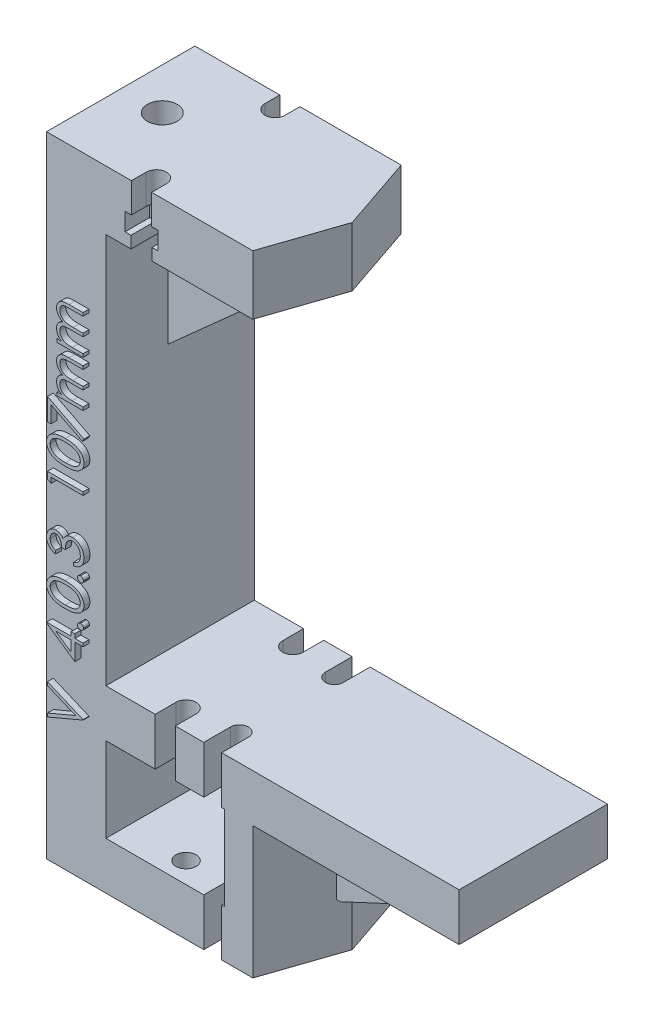
from build123d import *
from build123d.topology import SkipClean

# Parameters (mm, degrees)
BOSS_EXTRUDE2_DEPTH       = 12.5
BOSS_EXTRUDE3_DEPTH       = 25
CUT_EXTRUDE2_REACH        = 111.73
CUT_EXTRUDE3_REACH        = 111.73
BOSS_EXTRUDE5_DEPTH       = 2
CUT_EXTRUDE6_REACH        = 111.73
SKETCH30_W                = 10
SKETCH30_H                = 25
CUT_EXTRUDE8_DEPTH        = 8
CUT_EXTRUDE9_DEPTH        = 81.845467405
CUT_EXTRUDE9_DEPTH_BACK   = 81.845467405
BOSS_EXTRUDE6_DEPTH       = 1
BOSS_EXTRUDE7_DEPTH       = 40
BOSS_EXTRUDE17_DEPTH      = 2
CUT_EXTRUDE10_DEPTH       = 3
SKETCH39_W                = 4
SKETCH39_H                = 14.25
BOSS_EXTRUDE18_DEPTH      = 2.5
F_5_0MM_DOWEL_HOLE1_D     = 5
F_5_0MM_DOWEL_HOLE1_DEPTH = 5
F_5_0MM_DOWEL_HOLE1_TIP   = 1.502151548
SKETCH43_W                = 6
SKETCH43_H                = 4
BOSS_EXTRUDE19_DEPTH      = 2
BOSS_EXTRUDE20_DEPTH      = 8


with BuildPart() as part:
    # Sketch6 → Boss-Extrude2 (new, symmetric)
    with BuildSketch(Plane.XY):
        Polygon((-25, 53.055), (15, 53.055), (15, 45.055), (-15, 45.055), (-15, -45.055), (25, -45.055), (25, -53.055), (-25, -53.055), align=None)
    extrude(amount=BOSS_EXTRUDE2_DEPTH, both=True)

    # Sketch15 → Boss-Extrude3 (add)
    with BuildSketch(Plane.XY.offset(12.5)):
        Polygon((-15, -22.805), (15, -22.805), (15, -53.055), (5, -53.055), (5, -30.805), (-15, -30.805), align=None)
    extrude(amount=-BOSS_EXTRUDE3_DEPTH)

    # Sketch20 → Cut-Extrude2 (cut, up to next)
    with BuildSketch(Plane(origin=(0, 53.055, 0), x_dir=(1, 0, 0), z_dir=(0, 1, 0)), mode=Mode.PRIVATE) as cut_extrude2_sk1:
        with BuildLine():
            Line((-10.7, 12.5), (-10.7, 10))
            ThreePointArc((-10.7, 10), (-9, 8.3), (-7.3, 10))
            Line((-7.3, 10), (-7.3, 12.5))
            Line((-7.3, 12.5), (-10.7, 12.5))
        make_face()
    cut_extrude2_tool1 = extrude(cut_extrude2_sk1.sketch, amount=-CUT_EXTRUDE2_REACH, mode=Mode.PRIVATE) & part.part
    # Sketch20 → Cut-Extrude2 (cut, up to next)
    with BuildSketch(Plane(origin=(0, 53.055, 0), x_dir=(1, 0, 0), z_dir=(0, 1, 0)), mode=Mode.PRIVATE) as cut_extrude2_sk2:
        with BuildLine():
            Line((-7.3, -12.5), (-10.7, -12.5))
            Line((-10.7, -12.5), (-10.7, -10))
            ThreePointArc((-10.7, -10), (-9, -8.3), (-7.3, -10))
            Line((-7.3, -10), (-7.3, -12.5))
        make_face()
    cut_extrude2_tool2 = extrude(cut_extrude2_sk2.sketch, amount=-CUT_EXTRUDE2_REACH, mode=Mode.PRIVATE) & part.part
    add(cut_extrude2_tool1.solids().sort_by_distance((-9, 53.055, -10.563642))[0], mode=Mode.SUBTRACT)
    add(cut_extrude2_tool2.solids().sort_by_distance((-9, 53.055, 10.563642))[0], mode=Mode.SUBTRACT)

    # Cut-Extrude3: up to this face of the body (flat: up to its plane)
    cut_extrude3_end = Plane(part.part.faces().sort_by_distance((0, -22.805, 0))[0])
    # Sketch21 → Cut-Extrude3 (cut, up to the picked face)
    with BuildSketch(Plane.XZ.offset(53.055), mode=Mode.PRIVATE) as cut_extrude3_sk1:
        with BuildLine():
            Line((-6.7, 12.5), (-6.7, 9))
            ThreePointArc((-6.7, 9), (-5, 7.3), (-3.3, 9))
            Line((-3.3, 9), (-3.3, 12.5))
            Line((-3.3, 12.5), (-6.7, 12.5))
        make_face()
    cut_extrude3_tool1 = split(extrude(cut_extrude3_sk1.sketch, amount=-CUT_EXTRUDE3_REACH, mode=Mode.PRIVATE), bisect_by=cut_extrude3_end, keep=Keep.BOTH, mode=Mode.PRIVATE)
    # Sketch21 → Cut-Extrude3 (cut, up to the picked face)
    with BuildSketch(Plane.XZ.offset(53.055), mode=Mode.PRIVATE) as cut_extrude3_sk2:
        with BuildLine():
            Line((-3.3, -12.5), (-6.7, -12.5))
            Line((-6.7, -12.5), (-6.7, -9))
            ThreePointArc((-6.7, -9), (-5, -7.3), (-3.3, -9))
            Line((-3.3, -9), (-3.3, -12.5))
        make_face()
    cut_extrude3_tool2 = split(extrude(cut_extrude3_sk2.sketch, amount=-CUT_EXTRUDE3_REACH, mode=Mode.PRIVATE), bisect_by=cut_extrude3_end, keep=Keep.BOTH, mode=Mode.PRIVATE)
    add(cut_extrude3_tool1.solids().sort_by(Axis((-5, -53.055, 10.067524), (0, 1, 0)))[0], mode=Mode.SUBTRACT)
    add(cut_extrude3_tool2.solids().sort_by(Axis((-5, -53.055, -10.067524), (0, 1, 0)))[0], mode=Mode.SUBTRACT)

    # Sketch22 → Boss-Extrude5 (add, symmetric)
    with BuildSketch(Plane.XY):
        Polygon((-15, 21.805), (11, 45.055), (-15, 45.055), align=None)
    extrude(amount=BOSS_EXTRUDE5_DEPTH, both=True)

    # Cut-Extrude6: up to this face of the body (flat: up to its plane)
    cut_extrude6_end = Plane(part.part.faces().sort_by_distance((0.229244521, -22.805, 0))[0])
    # Sketch24 → Cut-Extrude6 (cut, up to the picked face)
    with BuildSketch(Plane.XZ.offset(53.055), mode=Mode.PRIVATE) as cut_extrude6_sk1:
        with BuildLine():
            Line((1.49, -12.5), (1.49, -8))
            ThreePointArc((1.49, -8), (3, -6.49), (4.51, -8))
            Line((4.51, -8), (4.51, -12.5))
            Line((4.51, -12.5), (1.49, -12.5))
        make_face()
    cut_extrude6_tool1 = split(extrude(cut_extrude6_sk1.sketch, amount=-CUT_EXTRUDE6_REACH, mode=Mode.PRIVATE), bisect_by=cut_extrude6_end, keep=Keep.BOTH, mode=Mode.PRIVATE)
    # Sketch24 → Cut-Extrude6 (cut, up to the picked face)
    with BuildSketch(Plane.XZ.offset(53.055), mode=Mode.PRIVATE) as cut_extrude6_sk2:
        with BuildLine():
            Line((4.51, 12.5), (1.49, 12.5))
            Line((1.49, 12.5), (1.49, 8))
            ThreePointArc((1.49, 8), (3, 6.49), (4.51, 8))
            Line((4.51, 8), (4.51, 12.5))
        make_face()
    cut_extrude6_tool2 = split(extrude(cut_extrude6_sk2.sketch, amount=-CUT_EXTRUDE6_REACH, mode=Mode.PRIVATE), bisect_by=cut_extrude6_end, keep=Keep.BOTH, mode=Mode.PRIVATE)
    add(cut_extrude6_tool1.solids().sort_by(Axis((3, -53.055, -9.647036), (0, 1, 0)))[0], mode=Mode.SUBTRACT)
    add(cut_extrude6_tool2.solids().sort_by(Axis((3, -53.055, 9.647036), (0, 1, 0)))[0], mode=Mode.SUBTRACT)

    # Sketch30 → Cut-Extrude8 (cut)
    with BuildSketch(Plane(origin=(0, -45.055, 0), x_dir=(1, 0, 0), z_dir=(0, 1, 0))):
        with Locations((20, 0)):
            Rectangle(SKETCH30_W, SKETCH30_H)
    extrude(amount=-CUT_EXTRUDE8_DEPTH, mode=Mode.SUBTRACT)

    # Sketch34 → Cut-Extrude9 (cut, two sides: drawn at the far end of the back side and taken through both)
    with BuildSketch(Plane(origin=(0, -22.805, 0), x_dir=(1, 0, 0), z_dir=(0, 1, 0)).offset(-CUT_EXTRUDE9_DEPTH_BACK)):
        Polygon((9.755, 12.5), (14, 0), (9.755, -12.5), (15, -12.5), (15, 12.5), align=None)
    extrude(amount=CUT_EXTRUDE9_DEPTH + CUT_EXTRUDE9_DEPTH_BACK, mode=Mode.SUBTRACT)

    # Sketch35 → Boss-Extrude6 (add)
    # profile 1 of 11: a face of its own
    with BuildSketch(Plane.XY.offset(12.5)):
        with BuildLine():
            Line((-22.234615385, 24.192307692), (-22.234615385, 24.730769231))
            Line((-22.234615385, 24.730769231), (-21.472596154, 24.730769231))
            add(Edge.make_bspline(
                [(-21.472596154, 24.730769231), (-21.539260614, 24.779256002), (-21.666996111, 24.872161304), (-21.835322312, 25.024502423), (-21.978170577, 25.176690044), (-22.053158357, 25.286290127), (-22.089182692, 25.338942308)],
                knots=[0, 0, 0, 0, 1.134379233, 2.173579362, 3.122582517, 4, 4, 4, 4], degree=3))
            add(Edge.make_bspline(
                [(-22.089182692, 25.338942308), (-22.123477604, 25.4107103), (-22.191468256, 25.552992414), (-22.260440071, 25.778282514), (-22.302825959, 26.008810519), (-22.308622599, 26.164481742), (-22.311538462, 26.242788462)],
                knots=[0, 0, 0, 0, 1.014936303, 2.012140481, 3.000054389, 4, 4, 4, 4], degree=3))
            add(Edge.make_bspline(
                [(-22.311538462, 26.242788462), (-22.309746507, 26.295747856), (-22.306200324, 26.400551651), (-22.283126386, 26.555839071), (-22.243239974, 26.706452288), (-22.187690322, 26.851510678), (-22.120389321, 26.988153705), (-22.041520642, 27.113523249), (-21.952811526, 27.225533553), (-21.851715073, 27.325979796), (-21.732621113, 27.415508457), (-21.593245652, 27.497285019), (-21.431579845, 27.573850863), (-21.314358593, 27.616020032), (-21.252644231, 27.638221154)],
                knots=[0, 0, 0, 0, 1.009731074, 1.9982035, 2.985760524, 3.974587072, 4.955028184, 5.885388378, 6.793242796, 7.673688873, 8.594941726, 9.625945874, 10.750113716, 12, 12, 12, 12], degree=3))
            add(Edge.make_bspline(
                [(-21.252644231, 27.638221154), (-21.295028488, 27.661726586), (-21.378434755, 27.707981975), (-21.496484081, 27.785642641), (-21.60687165, 27.867038436), (-21.709826129, 27.952731426), (-21.80452798, 28.043081494), (-21.892909205, 28.136632908), (-21.972522012, 28.235480687), (-22.065676161, 28.372206048), (-22.164941217, 28.549911297), (-22.248837086, 28.77483801), (-22.302266055, 29.00792588), (-22.308427236, 29.166379541), (-22.311538462, 29.246394231)],
                knots=[0, 0, 0, 0, 0.861026002, 1.694378253, 2.508904292, 3.297437177, 4.073006284, 4.833627155, 5.583069468, 6.325614666, 7.772320565, 9.187282923, 10.579656144, 12, 12, 12, 12], degree=3))
            add(Edge.make_bspline(
                [(-22.311538462, 29.246394231), (-22.308800813, 29.319918084), (-22.30344297, 29.463811403), (-22.260375554, 29.672941382), (-22.189095041, 29.868811401), (-22.088852441, 30.049345438), (-21.963482389, 30.212445671), (-21.814139706, 30.354757151), (-21.641369838, 30.473150863), (-21.480136821, 30.552300297), (-21.337524673, 30.604991229), (-21.215460368, 30.637898852), (-21.081004779, 30.666408831), (-20.934266049, 30.690580995), (-20.774947077, 30.708056361), (-20.602974661, 30.721047344), (-20.418199364, 30.729827776), (-20.290715767, 30.730449), (-20.225, 30.730769231)],
                knots=[0, 0, 0, 0, 1.209392158, 2.366897878, 3.497663982, 4.628180075, 5.751982922, 6.871462727, 8.009245026, 9.185977379, 9.818124946, 10.509294143, 11.264649411, 12.079922034, 12.956003306, 13.901808055, 14.918415426, 16, 16, 16, 16], degree=3))
            Line((-20.225, 30.730769231), (-17.85, 30.730769231))
            Line((-17.85, 30.730769231), (-17.85, 30.192307692))
            Line((-17.85, 30.192307692), (-20.227403846, 30.192307692))
            add(Edge.make_bspline(
                [(-20.227403846, 30.192307692), (-20.283496341, 30.192174827), (-20.391297586, 30.191919479), (-20.546014988, 30.187293303), (-20.687050044, 30.178620907), (-20.814586843, 30.168324713), (-20.928585361, 30.154407218), (-21.028726359, 30.136031786), (-21.115466742, 30.116719418), (-21.211587244, 30.08455919), (-21.317531947, 30.033623512), (-21.430954892, 29.954624495), (-21.530458078, 29.856584928), (-21.616841526, 29.742755056), (-21.687129696, 29.613262824), (-21.737313417, 29.470517893), (-21.768382244, 29.315438165), (-21.771478124, 29.2080846), (-21.773076923, 29.152644231)],
                knots=[0, 0, 0, 0, 1.253367865, 2.408782419, 3.458086102, 4.410454771, 5.267690823, 6.022776742, 6.685072793, 7.251272234, 8.28433411, 9.300106008, 10.325693114, 11.39283262, 12.482417211, 13.60372085, 14.762494729, 16, 16, 16, 16], degree=3))
            add(Edge.make_bspline(
                [(-21.773076923, 29.152644231), (-21.76997183, 29.084694057), (-21.763840459, 28.950518493), (-21.717743069, 28.753511816), (-21.641126709, 28.566211293), (-21.536341225, 28.389881475), (-21.407618816, 28.229169393), (-21.255294615, 28.090400459), (-21.082742522, 27.975853276), (-20.92307314, 27.898271209), (-20.779638783, 27.849257532), (-20.654327211, 27.816912839), (-20.511520556, 27.791601351), (-20.352893327, 27.768322423), (-20.177094809, 27.752611914), (-19.985210505, 27.738733404), (-19.775926859, 27.732154871), (-19.63085208, 27.731242787), (-19.555528846, 27.730769231)],
                knots=[0, 0, 0, 0, 1.091136677, 2.154576964, 3.231646693, 4.331257757, 5.439166191, 6.528231045, 7.628049365, 8.756709726, 9.369482423, 10.061167346, 10.833871401, 11.698739631, 12.636505159, 13.668922441, 14.789697963, 16, 16, 16, 16], degree=3))
            Line((-19.555528846, 27.730769231), (-17.85, 27.730769231))
            Line((-17.85, 27.730769231), (-17.85, 27.192307692))
            Line((-17.85, 27.192307692), (-20.079567308, 27.192307692))
            add(Edge.make_bspline(
                [(-20.079567308, 27.192307692), (-20.14247014, 27.192171525), (-20.263488866, 27.191909552), (-20.437032312, 27.187321582), (-20.594885583, 27.178601651), (-20.736865264, 27.168520735), (-20.862713168, 27.154017498), (-20.973104451, 27.137543847), (-21.067760922, 27.118088397), (-21.17158701, 27.085879819), (-21.285945136, 27.036637629), (-21.407983755, 26.957527458), (-21.514604324, 26.858340568), (-21.607034555, 26.743272236), (-21.682563185, 26.612793184), (-21.73505501, 26.468346445), (-21.767080197, 26.312298153), (-21.771040318, 26.204484643), (-21.773076923, 26.149038462)],
                knots=[0, 0, 0, 0, 1.320285835, 2.540097241, 3.643286278, 4.638464947, 5.527188413, 6.301437306, 6.980978976, 7.552872752, 8.580906713, 9.583871393, 10.589652407, 11.624542289, 12.671761011, 13.738681301, 14.837052193, 16, 16, 16, 16], degree=3))
            add(Edge.make_bspline(
                [(-21.773076923, 26.149038462), (-21.770453269, 26.08386783), (-21.765224419, 25.953985075), (-21.718160076, 25.763181453), (-21.644438314, 25.578921235), (-21.542166243, 25.404138051), (-21.415474903, 25.243567798), (-21.266504635, 25.10293032), (-21.097243672, 24.985144479), (-20.939930706, 24.906215351), (-20.800047184, 24.855613989), (-20.680645905, 24.822438089), (-20.548314964, 24.793318235), (-20.402780158, 24.771917094), (-20.24469108, 24.751192324), (-20.073236398, 24.741202166), (-19.888570334, 24.731478125), (-19.761074488, 24.731011325), (-19.694951923, 24.730769231)],
                knots=[0, 0, 0, 0, 1.09880202, 2.189873405, 3.297736452, 4.440485332, 5.596193377, 6.739822772, 7.886349079, 9.066114917, 9.699498033, 10.395421758, 11.156987371, 11.985484089, 12.878178647, 13.847820956, 14.883825601, 16, 16, 16, 16], degree=3))
            Line((-19.694951923, 24.730769231), (-17.85, 24.730769231))
            Line((-17.85, 24.730769231), (-17.85, 24.192307692))
            Line((-17.85, 24.192307692), (-22.234615385, 24.192307692))
        make_face()
    # profile 2 of 11: a face of its own
    with BuildSketch(Plane.XY.offset(12.5)):
        with BuildLine():
            Line((-22.234615385, 16.423076923), (-22.234615385, 16.961538462))
            Line((-22.234615385, 16.961538462), (-21.472596154, 16.961538462))
            add(Edge.make_bspline(
                [(-21.472596154, 16.961538462), (-21.539260614, 17.010025233), (-21.666996111, 17.102930535), (-21.835322312, 17.255271654), (-21.978170577, 17.407459275), (-22.053158357, 17.517059358), (-22.089182692, 17.569711538)],
                knots=[0, 0, 0, 0, 1.134379233, 2.173579362, 3.122582517, 4, 4, 4, 4], degree=3))
            add(Edge.make_bspline(
                [(-22.089182692, 17.569711538), (-22.123477604, 17.641479531), (-22.191468256, 17.783761645), (-22.260440071, 18.009051744), (-22.302825959, 18.239579749), (-22.308622599, 18.395250973), (-22.311538462, 18.473557692)],
                knots=[0, 0, 0, 0, 1.014936303, 2.012140481, 3.000054389, 4, 4, 4, 4], degree=3))
            add(Edge.make_bspline(
                [(-22.311538462, 18.473557692), (-22.309746507, 18.526517087), (-22.306200324, 18.631320881), (-22.283126386, 18.786608302), (-22.243239974, 18.937221519), (-22.187690322, 19.082279908), (-22.120389321, 19.218922936), (-22.041520642, 19.344292479), (-21.952811526, 19.456302784), (-21.851715073, 19.556749027), (-21.732621113, 19.646277688), (-21.593245652, 19.72805425), (-21.431579845, 19.804620094), (-21.314358593, 19.846789262), (-21.252644231, 19.868990385)],
                knots=[0, 0, 0, 0, 1.009731074, 1.9982035, 2.985760524, 3.974587072, 4.955028184, 5.885388378, 6.793242796, 7.673688873, 8.594941726, 9.625945874, 10.750113716, 12, 12, 12, 12], degree=3))
            add(Edge.make_bspline(
                [(-21.252644231, 19.868990385), (-21.295028488, 19.892495817), (-21.378434755, 19.938751206), (-21.496484081, 20.016411872), (-21.60687165, 20.097807667), (-21.709826129, 20.183500657), (-21.80452798, 20.273850725), (-21.892909205, 20.367402139), (-21.972522012, 20.466249918), (-22.065676161, 20.602975278), (-22.164941217, 20.780680527), (-22.248837086, 21.005607241), (-22.302266055, 21.238695111), (-22.308427236, 21.397148772), (-22.311538462, 21.477163462)],
                knots=[0, 0, 0, 0, 0.861026002, 1.694378253, 2.508904292, 3.297437177, 4.073006284, 4.833627155, 5.583069468, 6.325614666, 7.772320565, 9.187282923, 10.579656144, 12, 12, 12, 12], degree=3))
            add(Edge.make_bspline(
                [(-22.311538462, 21.477163462), (-22.308800813, 21.550687315), (-22.30344297, 21.694580634), (-22.260375554, 21.903710613), (-22.189095041, 22.099580632), (-22.088852441, 22.280114669), (-21.963482389, 22.443214902), (-21.814139706, 22.585526381), (-21.641369838, 22.703920094), (-21.480136821, 22.783069528), (-21.337524673, 22.83576046), (-21.215460368, 22.868668082), (-21.081004779, 22.897178062), (-20.934266049, 22.921350226), (-20.774947077, 22.938825592), (-20.602974661, 22.951816575), (-20.418199364, 22.960597007), (-20.290715767, 22.961218231), (-20.225, 22.961538462)],
                knots=[0, 0, 0, 0, 1.209392158, 2.366897878, 3.497663982, 4.628180075, 5.751982922, 6.871462727, 8.009245026, 9.185977379, 9.818124946, 10.509294143, 11.264649411, 12.079922034, 12.956003306, 13.901808055, 14.918415426, 16, 16, 16, 16], degree=3))
            Line((-20.225, 22.961538462), (-17.85, 22.961538462))
            Line((-17.85, 22.961538462), (-17.85, 22.423076923))
            Line((-17.85, 22.423076923), (-20.227403846, 22.423076923))
            add(Edge.make_bspline(
                [(-20.227403846, 22.423076923), (-20.283496341, 22.422944058), (-20.391297586, 22.42268871), (-20.546014988, 22.418062534), (-20.687050044, 22.409390138), (-20.814586843, 22.399093944), (-20.928585361, 22.385176449), (-21.028726359, 22.366801017), (-21.115466742, 22.347488649), (-21.211587244, 22.315328421), (-21.317531947, 22.264392743), (-21.430954892, 22.185393726), (-21.530458078, 22.087354159), (-21.616841526, 21.973524286), (-21.687129696, 21.844032054), (-21.737313417, 21.701287124), (-21.768382244, 21.546207396), (-21.771478124, 21.438853831), (-21.773076923, 21.383413462)],
                knots=[0, 0, 0, 0, 1.253367865, 2.408782419, 3.458086102, 4.410454771, 5.267690823, 6.022776742, 6.685072793, 7.251272234, 8.28433411, 9.300106008, 10.325693114, 11.39283262, 12.482417211, 13.60372085, 14.762494729, 16, 16, 16, 16], degree=3))
            add(Edge.make_bspline(
                [(-21.773076923, 21.383413462), (-21.76997183, 21.315463288), (-21.763840459, 21.181287724), (-21.717743069, 20.984281047), (-21.641126709, 20.796980524), (-21.536341225, 20.620650706), (-21.407618816, 20.459938624), (-21.255294615, 20.32116969), (-21.082742522, 20.206622507), (-20.92307314, 20.129040439), (-20.779638783, 20.080026763), (-20.654327211, 20.04768207), (-20.511520556, 20.022370582), (-20.352893327, 19.999091654), (-20.177094809, 19.983381145), (-19.985210505, 19.969502635), (-19.775926859, 19.962924102), (-19.63085208, 19.962012018), (-19.555528846, 19.961538462)],
                knots=[0, 0, 0, 0, 1.091136677, 2.154576964, 3.231646693, 4.331257757, 5.439166191, 6.528231045, 7.628049365, 8.756709726, 9.369482423, 10.061167346, 10.833871401, 11.698739631, 12.636505159, 13.668922441, 14.789697963, 16, 16, 16, 16], degree=3))
            Line((-19.555528846, 19.961538462), (-17.85, 19.961538462))
            Line((-17.85, 19.961538462), (-17.85, 19.423076923))
            Line((-17.85, 19.423076923), (-20.079567308, 19.423076923))
            add(Edge.make_bspline(
                [(-20.079567308, 19.423076923), (-20.14247014, 19.422940756), (-20.263488866, 19.422678783), (-20.437032312, 19.418090813), (-20.594885583, 19.409370882), (-20.736865264, 19.399289966), (-20.862713168, 19.384786728), (-20.973104451, 19.368313078), (-21.067760922, 19.348857627), (-21.17158701, 19.316649049), (-21.285945136, 19.267406859), (-21.407983755, 19.188296688), (-21.514604324, 19.089109799), (-21.607034555, 18.974041467), (-21.682563185, 18.843562414), (-21.73505501, 18.699115676), (-21.767080197, 18.543067384), (-21.771040318, 18.435253873), (-21.773076923, 18.379807692)],
                knots=[0, 0, 0, 0, 1.320285835, 2.540097241, 3.643286278, 4.638464947, 5.527188413, 6.301437306, 6.980978976, 7.552872752, 8.580906713, 9.583871393, 10.589652407, 11.624542289, 12.671761011, 13.738681301, 14.837052193, 16, 16, 16, 16], degree=3))
            add(Edge.make_bspline(
                [(-21.773076923, 18.379807692), (-21.770453269, 18.314637061), (-21.765224419, 18.184754306), (-21.718160076, 17.993950684), (-21.644438314, 17.809690466), (-21.542166243, 17.634907282), (-21.415474903, 17.474337029), (-21.266504635, 17.333699551), (-21.097243672, 17.215913709), (-20.939930706, 17.136984582), (-20.800047184, 17.08638322), (-20.680645905, 17.05320732), (-20.548314964, 17.024087466), (-20.402780158, 17.002686325), (-20.24469108, 16.981961555), (-20.073236398, 16.971971397), (-19.888570334, 16.962247356), (-19.761074488, 16.961780556), (-19.694951923, 16.961538462)],
                knots=[0, 0, 0, 0, 1.09880202, 2.189873405, 3.297736452, 4.440485332, 5.596193377, 6.739822772, 7.886349079, 9.066114917, 9.699498033, 10.395421758, 11.156987371, 11.985484089, 12.878178647, 13.847820956, 14.883825601, 16, 16, 16, 16], degree=3))
            Line((-19.694951923, 16.961538462), (-17.85, 16.961538462))
            Line((-17.85, 16.961538462), (-17.85, 16.423076923))
            Line((-17.85, 16.423076923), (-22.234615385, 16.423076923))
        make_face()
    # profile 3 of 11: a face of its own
    with BuildSketch(Plane.XY.offset(12.5)):
        Polygon((-23.85, 11.807692308), (-23.85, 15.5), (-17.696153846, 12.346153846), (-17.952163462, 11.881009615), (-23.234615385, 14.588942308), (-23.234615385, 11.807692308), align=None)
    # profile 4 of 11: a face of its own
    with BuildSketch(Plane.XY.offset(12.5)):
        with BuildLine():
            add(Edge.make_bspline(
                [(-20.847596154, 6.807692308), (-20.943763104, 6.808254625), (-21.130568792, 6.809346933), (-21.402771035, 6.821498512), (-21.658131531, 6.841684813), (-21.8966625, 6.869348882), (-22.118425529, 6.903013987), (-22.322827956, 6.947954834), (-22.5108159, 6.999062452), (-22.683002111, 7.058295363), (-22.841707287, 7.125131068), (-22.989862864, 7.197877295), (-23.12725581, 7.279410631), (-23.256039225, 7.365107901), (-23.374246225, 7.458305288), (-23.483238776, 7.557004464), (-23.582097725, 7.663179426), (-23.67089077, 7.775800373), (-23.748749314, 7.894104021), (-23.817752138, 8.014857575), (-23.874589397, 8.14021863), (-23.921083839, 8.26853688), (-23.959038325, 8.400082771), (-23.985109169, 8.53482272), (-24.001483733, 8.673069065), (-24.003051209, 8.766379549), (-24.003846154, 8.813701923)],
                knots=[0, 0, 0, 0, 1.646148282, 3.197666765, 4.66315463, 6.030252048, 7.307778049, 8.501004361, 9.610818041, 10.641065266, 11.615491391, 12.557119604, 13.464013759, 14.348536654, 15.203310953, 16.038349431, 16.863300206, 17.683791446, 18.490318933, 19.285717724, 20.06220424, 20.843281102, 21.620494212, 22.403315558, 23.190242141, 24, 24, 24, 24], degree=3))
            add(Edge.make_bspline(
                [(-24.003846154, 8.813701923), (-24.003184011, 8.861443028), (-24.00186658, 8.956431023), (-23.983322948, 9.096359849), (-23.959388145, 9.233851353), (-23.921000663, 9.366819518), (-23.875065063, 9.497778517), (-23.814453767, 9.62347166), (-23.748534277, 9.748336583), (-23.668118043, 9.866700838), (-23.579244872, 9.982100932), (-23.478351101, 10.090276472), (-23.368228979, 10.193992714), (-23.246422458, 10.289332334), (-23.114799194, 10.380381458), (-22.972255805, 10.463683769), (-22.819108188, 10.540971802), (-22.656066311, 10.613698368), (-22.478775073, 10.677295829), (-22.288340287, 10.733839056), (-22.083037474, 10.780185797), (-21.8640103, 10.818513738), (-21.630173709, 10.848263516), (-21.382001479, 10.869914901), (-21.119338352, 10.881355776), (-20.939753411, 10.883509938), (-20.847596154, 10.884615385)],
                knots=[0, 0, 0, 0, 0.810910589, 1.61342667, 2.396193133, 3.181089899, 3.963115317, 4.752255436, 5.550715454, 6.36105385, 7.181178335, 8.024612154, 8.872680183, 9.750181803, 10.651284446, 11.591556747, 12.554036451, 13.566402641, 14.62422919, 15.753422176, 16.94128843, 18.199818041, 19.531985927, 20.947085226, 22.433341622, 24, 24, 24, 24], degree=3))
            add(Edge.make_bspline(
                [(-20.847596154, 10.884615385), (-20.755841687, 10.883485617), (-20.576661658, 10.881279384), (-20.315168068, 10.870160276), (-20.06833354, 10.847734672), (-19.835894914, 10.820092294), (-19.61774442, 10.781335965), (-19.414024206, 10.734637795), (-19.22401301, 10.681432174), (-19.049072236, 10.616858663), (-18.886313286, 10.545824867), (-18.734291753, 10.46861977), (-18.591786008, 10.385787548), (-18.459815568, 10.296103949), (-18.338497958, 10.199196089), (-18.227998136, 10.095552543), (-18.126462639, 9.986432504), (-18.036610349, 9.870359647), (-17.955581867, 9.750892902), (-17.887270195, 9.626015294), (-17.828082139, 9.498922777), (-17.779690445, 9.368346453), (-17.74216212, 9.234487925), (-17.716363441, 9.096902184), (-17.698228951, 8.956411277), (-17.696847943, 8.861436423), (-17.696153846, 8.813701923)],
                knots=[0, 0, 0, 0, 1.561645053, 3.049612875, 4.452756685, 5.778837748, 7.032101753, 8.221335837, 9.334924186, 10.387562255, 11.392109817, 12.355697819, 13.287721948, 14.19548756, 15.068665045, 15.927346723, 16.771751757, 17.602390507, 18.423119567, 19.225778204, 20.022010933, 20.807278863, 21.593079439, 22.384715467, 23.188155646, 24, 24, 24, 24], degree=3))
            add(Edge.make_bspline(
                [(-17.696153846, 8.813701923), (-17.696953313, 8.766380585), (-17.698529705, 8.673072142), (-17.714838958, 8.534810841), (-17.741059822, 8.400612368), (-17.777773997, 8.269814499), (-17.82271373, 8.141746208), (-17.88126285, 8.018152496), (-17.948692879, 7.897659616), (-18.025484279, 7.780587265), (-18.113467177, 7.669142095), (-18.210766452, 7.562671154), (-18.319877187, 7.463947639), (-18.439081549, 7.371558356), (-18.568056572, 7.284955113), (-18.706888809, 7.204126332), (-18.855815319, 7.129854561), (-19.015774756, 7.06187698), (-19.189183067, 7.001607269), (-19.377650209, 6.948575809), (-19.583090447, 6.90622121), (-19.80446072, 6.87031914), (-20.042210834, 6.841550341), (-20.296426807, 6.821506894), (-20.566625901, 6.809356158), (-20.752230327, 6.808257045), (-20.847596154, 6.807692308)],
                knots=[0, 0, 0, 0, 0.810927267, 1.598990287, 2.382942141, 3.152806972, 3.926217614, 4.706701772, 5.493896336, 6.292070767, 7.104102563, 7.925577746, 8.761822141, 9.623241997, 10.509042271, 11.423174113, 12.375371989, 13.360203808, 14.400680605, 15.520553799, 16.714061498, 17.994519714, 19.364400916, 20.818312473, 22.365209998, 24, 24, 24, 24], degree=3))
        make_face()
        with BuildLine():
            add(Edge.make_bspline(
                [(-20.85, 7.346153846), (-20.769859694, 7.346363103), (-20.614323096, 7.346769228), (-20.388701112, 7.357071927), (-20.177909913, 7.371412233), (-19.982031768, 7.389453163), (-19.801751265, 7.416472021), (-19.636318913, 7.447126567), (-19.486040925, 7.483894824), (-19.349604048, 7.527612784), (-19.225076282, 7.577411794), (-19.109138521, 7.631688098), (-19.000416685, 7.690512961), (-18.899174551, 7.755092167), (-18.806649691, 7.826702492), (-18.720496813, 7.902024071), (-18.643712237, 7.984450102), (-18.551605787, 8.098451448), (-18.456431673, 8.248962083), (-18.373552195, 8.438596427), (-18.321468101, 8.63345681), (-18.314844504, 8.765716072), (-18.311538462, 8.831730769)],
                knots=[0, 0, 0, 0, 1.459098681, 2.831824031, 4.11146945, 5.306290378, 6.412266529, 7.42953815, 8.369053297, 9.227277979, 10.03601793, 10.809473603, 11.557037441, 12.285528272, 12.993193355, 13.685654407, 14.36688038, 15.041354379, 16.352855396, 17.594313975, 18.799247529, 20, 20, 20, 20], degree=3))
            add(Edge.make_bspline(
                [(-18.311538462, 8.831730769), (-18.314433297, 8.8981276), (-18.320212699, 9.030685739), (-18.370653042, 9.225367123), (-18.452653022, 9.4128011), (-18.546336056, 9.560722008), (-18.636124672, 9.67294532), (-18.712589838, 9.75338114), (-18.798233217, 9.827199934), (-18.89063069, 9.897215436), (-18.991555316, 9.961430851), (-19.100519627, 10.019824842), (-19.217826818, 10.073110569), (-19.299717795, 10.103468935), (-19.341586538, 10.118990385)],
                knots=[0, 0, 0, 0, 1.353621445, 2.702441307, 4.075953605, 5.516772412, 6.261413105, 7.007624062, 7.778524365, 8.566925914, 9.372323995, 10.217594641, 11.088702136, 12, 12, 12, 12], degree=3))
            add(Edge.make_bspline(
                [(-19.341586538, 10.118990385), (-19.395123235, 10.137079129), (-19.503825688, 10.173807039), (-19.672449091, 10.221141509), (-19.849368115, 10.258419336), (-20.033525458, 10.291956535), (-20.226279231, 10.314847488), (-20.427033032, 10.33327231), (-20.635938225, 10.344124917), (-20.777872495, 10.345470204), (-20.85, 10.346153846)],
                knots=[0, 0, 0, 0, 0.884706709, 1.796334032, 2.740027952, 3.714592787, 4.726048262, 5.777819803, 6.87074269, 8, 8, 8, 8], degree=3))
            add(Edge.make_bspline(
                [(-20.85, 10.346153846), (-20.922115839, 10.345210665), (-21.063189835, 10.3433656), (-21.269792431, 10.336313049), (-21.466022878, 10.318101208), (-21.652726545, 10.297874146), (-21.828869925, 10.268050342), (-21.995927577, 10.235894088), (-22.151829954, 10.192692057), (-22.299017639, 10.146543708), (-22.435819346, 10.093726455), (-22.562869531, 10.035583233), (-22.680793265, 9.973495653), (-22.789226195, 9.906027824), (-22.888797281, 9.834119505), (-22.977215398, 9.755192469), (-23.058781601, 9.674259166), (-23.150223336, 9.559154948), (-23.244194815, 9.40968862), (-23.328320624, 9.222419092), (-23.378108547, 9.028603204), (-23.38501303, 8.897307597), (-23.388461538, 8.831730769)],
                knots=[0, 0, 0, 0, 1.313483664, 2.569454835, 3.763100662, 4.901599063, 5.988328865, 7.015709358, 7.99797933, 8.932480776, 9.824041341, 10.666387587, 11.475829342, 12.24921787, 12.990555181, 13.709176526, 14.405678811, 15.080244297, 16.38186033, 17.610124501, 18.806354173, 20, 20, 20, 20], degree=3))
            add(Edge.make_bspline(
                [(-23.388461538, 8.831730769), (-23.38500445, 8.765359674), (-23.378083976, 8.63249657), (-23.328550878, 8.436610909), (-23.24444095, 8.248076263), (-23.150404383, 8.09811705), (-23.059132198, 7.984411155), (-22.981449059, 7.903722786), (-22.897353903, 7.827356599), (-22.804008242, 7.757600615), (-22.703122835, 7.693404346), (-22.595806963, 7.632306111), (-22.479652573, 7.578755625), (-22.355222453, 7.528796737), (-22.218778072, 7.485005857), (-22.067956326, 7.448657718), (-21.90212891, 7.415567035), (-21.720531175, 7.39173635), (-21.524611224, 7.37075185), (-21.313280962, 7.357229358), (-21.086884212, 7.346722031), (-20.930542894, 7.346347035), (-20.85, 7.346153846)],
                knots=[0, 0, 0, 0, 1.207546505, 2.417292871, 3.651582144, 4.952510111, 5.626719005, 6.30238548, 6.989136872, 7.692112372, 8.420316868, 9.164734959, 9.937886623, 10.746308695, 11.604196049, 12.543341915, 13.568754172, 14.680483261, 15.875568977, 17.154711427, 18.534182925, 20, 20, 20, 20], degree=3))
        make_face(mode=Mode.SUBTRACT)
    # profile 5 of 11: a face of its own
    with BuildSketch(Plane.XY.offset(12.5)):
        Polygon((-23.85, 3.467548077), (-23.85, 4.576923077), (-17.85, 4.576923077), (-17.85, 4.038461538), (-23.234615385, 4.038461538), (-23.234615385, 3.115384615), align=None)
    # profile 6 of 11: a face of its own
    with BuildSketch(Plane.XY.offset(12.5)):
        with BuildLine():
            Line((-22.465384615, -6.269230769), (-22.465384615, -6.807692308))
            add(Edge.make_bspline(
                [(-22.465384615, -6.807692308), (-22.525783159, -6.793104507), (-22.643857373, -6.764586548), (-22.812555534, -6.705104994), (-22.972195856, -6.640306271), (-23.119789126, -6.562496377), (-23.25830153, -6.477624227), (-23.384591458, -6.380385276), (-23.501870827, -6.275265751), (-23.605950663, -6.15899441), (-23.700198199, -6.037059561), (-23.78055544, -5.90774307), (-23.849682559, -5.773646681), (-23.906631528, -5.63384131), (-23.949532426, -5.48791073), (-23.980658378, -5.337174233), (-24.000871717, -5.181236804), (-24.002844454, -5.075383792), (-24.003846154, -5.021634615)],
                knots=[0, 0, 0, 0, 1.162005537, 2.271625781, 3.343758855, 4.383309926, 5.390229558, 6.379919256, 7.361854164, 8.333198761, 9.295911338, 10.242430842, 11.177959212, 12.116337295, 13.062827104, 14.020064771, 14.994644689, 16, 16, 16, 16], degree=3))
            add(Edge.make_bspline(
                [(-24.003846154, -5.021634615), (-24.001481759, -4.943321343), (-23.996804544, -4.788403039), (-23.954094082, -4.560809244), (-23.88650814, -4.341334697), (-23.793124608, -4.132381701), (-23.677946357, -3.938292959), (-23.540863951, -3.765602353), (-23.384522291, -3.61665062), (-23.211837895, -3.49168883), (-23.027285593, -3.393845975), (-22.837342467, -3.321697906), (-22.642459087, -3.277775024), (-22.51087518, -3.272082641), (-22.444951923, -3.269230769)],
                knots=[0, 0, 0, 0, 1.083050992, 2.142477498, 3.193116406, 4.255571735, 5.30263384, 6.308962982, 7.297363603, 8.282367274, 9.249857812, 10.179914175, 11.08814088, 12, 12, 12, 12], degree=3))
            add(Edge.make_bspline(
                [(-22.444951923, -3.269230769), (-22.381511704, -3.271225497), (-22.257369039, -3.275128869), (-22.076132187, -3.308272364), (-21.905318015, -3.364048815), (-21.744207451, -3.441311265), (-21.593822011, -3.541325351), (-21.453823341, -3.662478546), (-21.323590499, -3.805625966), (-21.248985688, -3.914104145), (-21.210576923, -3.969951923)],
                knots=[0, 0, 0, 0, 1.024540389, 2.004866551, 2.965041327, 3.920577974, 4.882998113, 5.874504559, 6.905732034, 8, 8, 8, 8], degree=3))
            add(Edge.make_bspline(
                [(-21.210576923, -3.969951923), (-21.179868928, -3.906044704), (-21.118928904, -3.779220814), (-20.997517259, -3.608098376), (-20.860777611, -3.450386685), (-20.752876434, -3.363467629), (-20.698557692, -3.319711538)],
                knots=[0, 0, 0, 0, 1.015663554, 2.015584519, 3.001021554, 4, 4, 4, 4], degree=3))
            add(Edge.make_bspline(
                [(-20.698557692, -3.319711538), (-20.659030118, -3.290840666), (-20.580622261, -3.233571701), (-20.454559817, -3.162882215), (-20.327100121, -3.098752305), (-20.194826853, -3.0487805), (-20.059273116, -3.010082443), (-19.920206151, -2.982420673), (-19.777512398, -2.965236431), (-19.680976718, -2.962775485), (-19.632451923, -2.961538462)],
                knots=[0, 0, 0, 0, 1.025084078, 2.033381695, 3.024893161, 4.013698104, 4.991890475, 5.976764909, 6.982997093, 8, 8, 8, 8], degree=3))
            add(Edge.make_bspline(
                [(-19.632451923, -2.961538462), (-19.548435688, -2.964615214), (-19.380798599, -2.970754239), (-19.133121205, -3.025611716), (-18.891045463, -3.110688915), (-18.659391618, -3.231372128), (-18.442856494, -3.379116366), (-18.247684864, -3.552943958), (-18.082552995, -3.755339982), (-17.942909403, -3.978969255), (-17.832322748, -4.222293171), (-17.752615907, -4.481484505), (-17.704807811, -4.755043283), (-17.699071344, -4.942116457), (-17.696153846, -5.037259615)],
                knots=[0, 0, 0, 0, 0.955697303, 1.906897079, 2.875188111, 3.870982192, 4.871999088, 5.854111427, 6.836107184, 7.836239895, 8.848948182, 9.870701427, 10.917064451, 12, 12, 12, 12], degree=3))
            add(Edge.make_bspline(
                [(-17.696153846, -5.037259615), (-17.697655193, -5.101402949), (-17.700609344, -5.227615642), (-17.720444922, -5.41323343), (-17.757657916, -5.590038831), (-17.804458406, -5.759748696), (-17.869165328, -5.91980169), (-17.946307965, -6.072500026), (-18.037864541, -6.217174374), (-18.143989026, -6.35296556), (-18.262779517, -6.479728509), (-18.396209457, -6.594233721), (-18.54178858, -6.697748075), (-18.700826395, -6.789613852), (-18.872877459, -6.870217681), (-19.058631212, -6.93782496), (-19.256647609, -6.996854467), (-19.394603295, -7.024352859), (-19.465384615, -7.038461538)],
                knots=[0, 0, 0, 0, 1.048603596, 2.063302207, 3.045874044, 3.999447474, 4.937100059, 5.862643889, 6.7929026, 7.7308982, 8.676022965, 9.627908155, 10.600123445, 11.591992905, 12.626222643, 13.701663232, 14.820785756, 16, 16, 16, 16], degree=3))
            Line((-19.465384615, -7.038461538), (-19.465384615, -6.5))
            add(Edge.make_bspline(
                [(-19.465384615, -6.5), (-19.419186307, -6.4859715), (-19.329326584, -6.45868485), (-19.200000346, -6.412237482), (-19.081443683, -6.359320444), (-18.972786903, -6.302552629), (-18.872959927, -6.242932436), (-18.784602437, -6.176221136), (-18.703833519, -6.107359744), (-18.65832847, -6.055452281), (-18.636057692, -6.030048077)],
                knots=[0, 0, 0, 0, 1.198163088, 2.33053128, 3.407730985, 4.417276592, 5.372219308, 6.28897303, 7.162600585, 8, 8, 8, 8], degree=3))
            add(Edge.make_bspline(
                [(-18.636057692, -6.030048077), (-18.610168371, -5.996450194), (-18.558469643, -5.929358136), (-18.492306569, -5.820097482), (-18.435672559, -5.704786707), (-18.389638063, -5.582464202), (-18.355082909, -5.453113557), (-18.330211736, -5.317259472), (-18.313792897, -5.174679045), (-18.312300901, -5.07737069), (-18.311538462, -5.027644231)],
                knots=[0, 0, 0, 0, 0.946083416, 1.889246487, 2.84504177, 3.809995578, 4.801312957, 5.829064617, 6.89060985, 8, 8, 8, 8], degree=3))
            add(Edge.make_bspline(
                [(-18.311538462, -5.027644231), (-18.312594299, -4.971495369), (-18.314658898, -4.861701117), (-18.333645824, -4.701492787), (-18.361297962, -4.54908002), (-18.404005932, -4.406155004), (-18.456773106, -4.270845563), (-18.523027515, -4.145048449), (-18.600761324, -4.027112267), (-18.689114167, -3.918547572), (-18.78583673, -3.820926702), (-18.887001995, -3.734973251), (-18.992183417, -3.661902403), (-19.101963053, -3.602959126), (-19.215886303, -3.556415325), (-19.334272867, -3.524729839), (-19.456153895, -3.50269867), (-19.539003556, -3.500904477), (-19.580769231, -3.5)],
                knots=[0, 0, 0, 0, 1.217147791, 2.380027433, 3.494444702, 4.572153297, 5.609568379, 6.639424714, 7.649109417, 8.668170816, 9.669597737, 10.625200337, 11.543417969, 12.441394052, 13.322311151, 14.205496177, 15.095365482, 16, 16, 16, 16], degree=3))
            add(Edge.make_bspline(
                [(-19.580769231, -3.5), (-19.636670808, -3.502628894), (-19.748195803, -3.507873602), (-19.912336629, -3.547748483), (-20.0705422, -3.613927422), (-20.220763474, -3.704759271), (-20.358292416, -3.818033473), (-20.481878404, -3.948394552), (-20.58375865, -4.099389), (-20.654213534, -4.238257889), (-20.702274605, -4.3612871), (-20.734289416, -4.466569854), (-20.761398361, -4.58443855), (-20.786619453, -4.713466505), (-20.808084605, -4.854626326), (-20.825984865, -5.007764214), (-20.840307791, -5.172911235), (-20.846703955, -5.287238948), (-20.85, -5.346153846)],
                knots=[0, 0, 0, 0, 1.070505987, 2.135685285, 3.216438728, 4.346150463, 5.486482244, 6.621737109, 7.7759408, 8.963942283, 9.59839197, 10.305095457, 11.070459627, 11.915156775, 12.823989992, 13.805807174, 14.869297358, 16, 16, 16, 16], degree=3))
            Line((-20.85, -5.346153846), (-21.465384615, -5.346153846))
            add(Edge.make_bspline(
                [(-21.465384615, -5.346153846), (-21.466825844, -5.271950102), (-21.46964787, -5.126654021), (-21.496930581, -4.913851625), (-21.540730059, -4.711225391), (-21.603311952, -4.521688121), (-21.677025864, -4.349265278), (-21.762200254, -4.199073734), (-21.858603907, -4.075067341), (-21.964391072, -3.975950564), (-22.077232432, -3.900614851), (-22.195562908, -3.846435584), (-22.3198516, -3.814144693), (-22.404704726, -3.809850676), (-22.447355769, -3.807692308)],
                knots=[0, 0, 0, 0, 1.322091412, 2.58874672, 3.817242262, 5.011895168, 6.140903042, 7.155122731, 8.080855046, 8.929742606, 9.727943956, 10.488587771, 11.240295418, 12, 12, 12, 12], degree=3))
            add(Edge.make_bspline(
                [(-22.447355769, -3.807692308), (-22.47869426, -3.808387179), (-22.541040702, -3.809769592), (-22.632413233, -3.827896523), (-22.720988495, -3.853883396), (-22.805756581, -3.891613213), (-22.88689098, -3.940498028), (-22.965281732, -3.99946272), (-23.03991592, -4.070187803), (-23.111178585, -4.149400664), (-23.176007889, -4.237115144), (-23.232744257, -4.331285166), (-23.280874212, -4.431528881), (-23.32069457, -4.537204158), (-23.350615792, -4.648803455), (-23.372108323, -4.765761319), (-23.385543602, -4.888312176), (-23.387478126, -4.971920784), (-23.388461538, -5.014423077)],
                knots=[0, 0, 0, 0, 0.884325644, 1.759323928, 2.622595547, 3.489424008, 4.37295195, 5.294616785, 6.255907374, 7.274251867, 8.302369084, 9.333474657, 10.37669385, 11.44084034, 12.520297356, 13.637342342, 14.798947025, 16, 16, 16, 16], degree=3))
            add(Edge.make_bspline(
                [(-23.388461538, -5.014423077), (-23.386076346, -5.082740222), (-23.381417512, -5.216179496), (-23.340612346, -5.408547925), (-23.27550706, -5.587381069), (-23.197793312, -5.724075926), (-23.121078283, -5.825017482), (-23.054079906, -5.897149376), (-22.979623637, -5.967984536), (-22.893123565, -6.032862839), (-22.800437639, -6.098475371), (-22.696854185, -6.158208905), (-22.585075223, -6.216254092), (-22.506054136, -6.251229891), (-22.465384615, -6.269230769)],
                knots=[0, 0, 0, 0, 1.472543308, 2.876219568, 4.221790263, 5.565193594, 6.249813518, 6.953379497, 7.687249741, 8.463570142, 9.283606569, 10.136032583, 11.040678096, 12, 12, 12, 12], degree=3))
        make_face()
    # profile 7 of 11: a face of its own
    with BuildSketch(Plane.XY.offset(12.5)):
        with BuildLine():
            add(Edge.make_bspline(
                [(-18.773076923, -8.384615385), (-18.771091494, -8.351203592), (-18.767199294, -8.28570368), (-18.740496425, -8.191008031), (-18.693081578, -8.1053029), (-18.629888244, -8.028961909), (-18.553267107, -7.966036521), (-18.468245549, -7.916931917), (-18.372757105, -7.890461657), (-18.306877662, -7.886597808), (-18.273076923, -7.884615385)],
                knots=[0, 0, 0, 0, 1.020151414, 1.999887582, 2.974338812, 3.990962822, 5.007586832, 5.987933904, 6.967670073, 8, 8, 8, 8], degree=3))
            add(Edge.make_bspline(
                [(-18.273076923, -7.884615385), (-18.240082695, -7.886658673), (-18.17501856, -7.890688008), (-18.080332316, -7.91694386), (-17.995213248, -7.965976911), (-17.918771705, -8.029362272), (-17.854052036, -8.104846357), (-17.807265803, -8.191276168), (-17.778559122, -8.285464217), (-17.774926676, -8.351160715), (-17.773076923, -8.384615385)],
                knots=[0, 0, 0, 0, 1.009624703, 1.990965087, 2.972917375, 3.991206001, 5.017354006, 5.993400798, 6.978178195, 8, 8, 8, 8], degree=3))
            add(Edge.make_bspline(
                [(-17.773076923, -8.384615385), (-17.774859529, -8.418094148), (-17.778339643, -8.483453465), (-17.807852551, -8.577290359), (-17.853605582, -8.664246963), (-17.918889524, -8.739711432), (-17.994817845, -8.803610445), (-18.080918523, -8.850468116), (-18.174747202, -8.879000461), (-18.240029244, -8.882728262), (-18.273076923, -8.884615385)],
                knots=[0, 0, 0, 0, 1.022258411, 1.995716197, 2.98297171, 4.009558169, 5.028281891, 6.00474573, 6.989943903, 8, 8, 8, 8], degree=3))
            add(Edge.make_bspline(
                [(-18.273076923, -8.884615385), (-18.306933002, -8.882794643), (-18.373032842, -8.879239869), (-18.467659884, -8.850481594), (-18.553662923, -8.803550945), (-18.629771346, -8.740113125), (-18.693521007, -8.66378576), (-18.739917796, -8.577563694), (-18.767415645, -8.483210197), (-18.771157102, -8.418050302), (-18.773076923, -8.384615385)],
                knots=[0, 0, 0, 0, 1.032775665, 2.016367738, 2.991239715, 4.008302682, 5.025365648, 6.011011707, 6.979408107, 8, 8, 8, 8], degree=3))
        make_face()
    # profile 8 of 11: a face of its own
    with BuildSketch(Plane.XY.offset(12.5)):
        with BuildLine():
            add(Edge.make_bspline(
                [(-20.847596154, -13.961538462), (-20.943763104, -13.960976145), (-21.130568792, -13.959883836), (-21.402771035, -13.947732257), (-21.658131531, -13.927545957), (-21.8966625, -13.899881888), (-22.118425529, -13.866216783), (-22.322827956, -13.821275935), (-22.5108159, -13.770168317), (-22.683002111, -13.710935407), (-22.841707287, -13.644099701), (-22.989862864, -13.571353475), (-23.12725581, -13.489820138), (-23.256039225, -13.404122868), (-23.374246225, -13.310925481), (-23.483238776, -13.212226305), (-23.582097725, -13.106051343), (-23.67089077, -12.993430396), (-23.748749314, -12.875126748), (-23.817752138, -12.754373195), (-23.874589397, -12.629012139), (-23.921083839, -12.500693889), (-23.959038325, -12.369147998), (-23.985109169, -12.234408049), (-24.001483733, -12.096161704), (-24.003051209, -12.00285122), (-24.003846154, -11.955528846)],
                knots=[0, 0, 0, 0, 1.646148282, 3.197666765, 4.66315463, 6.030252048, 7.307778049, 8.501004361, 9.610818041, 10.641065266, 11.615491391, 12.557119604, 13.464013759, 14.348536654, 15.203310953, 16.038349431, 16.863300206, 17.683791446, 18.490318933, 19.285717724, 20.06220424, 20.843281102, 21.620494212, 22.403315558, 23.190242141, 24, 24, 24, 24], degree=3))
            add(Edge.make_bspline(
                [(-24.003846154, -11.955528846), (-24.003184011, -11.907787742), (-24.00186658, -11.812799746), (-23.983322948, -11.67287092), (-23.959388145, -11.535379416), (-23.921000663, -11.402411251), (-23.875065063, -11.271452253), (-23.814453767, -11.145759109), (-23.748534277, -11.020894186), (-23.668118043, -10.902529931), (-23.579244872, -10.787129837), (-23.478351101, -10.678954297), (-23.368228979, -10.575238056), (-23.246422458, -10.479898435), (-23.114799194, -10.388849311), (-22.972255805, -10.305547), (-22.819108188, -10.228258967), (-22.656066311, -10.155532402), (-22.478775073, -10.09193494), (-22.288340287, -10.035391714), (-22.083037474, -9.989044972), (-21.8640103, -9.950717032), (-21.630173709, -9.920967254), (-21.382001479, -9.899315868), (-21.119338352, -9.887874993), (-20.939753411, -9.885720832), (-20.847596154, -9.884615385)],
                knots=[0, 0, 0, 0, 0.810910589, 1.61342667, 2.396193133, 3.181089899, 3.963115317, 4.752255436, 5.550715454, 6.36105385, 7.181178335, 8.024612154, 8.872680183, 9.750181803, 10.651284446, 11.591556747, 12.554036451, 13.566402641, 14.62422919, 15.753422176, 16.94128843, 18.199818041, 19.531985927, 20.947085226, 22.433341622, 24, 24, 24, 24], degree=3))
            add(Edge.make_bspline(
                [(-20.847596154, -9.884615385), (-20.755841687, -9.885745152), (-20.576661658, -9.887951385), (-20.315168068, -9.899070493), (-20.06833354, -9.921496097), (-19.835894914, -9.949138476), (-19.61774442, -9.987894804), (-19.414024206, -10.034592974), (-19.22401301, -10.087798595), (-19.049072236, -10.152372106), (-18.886313286, -10.223405902), (-18.734291753, -10.300610999), (-18.591786008, -10.383443221), (-18.459815568, -10.47312682), (-18.338497958, -10.57003468), (-18.227998136, -10.673678226), (-18.126462639, -10.782798265), (-18.036610349, -10.898871122), (-17.955581867, -11.018337867), (-17.887270195, -11.143215475), (-17.828082139, -11.270307993), (-17.779690445, -11.400884316), (-17.74216212, -11.534742844), (-17.716363441, -11.672328586), (-17.698228951, -11.812819492), (-17.696847943, -11.907794346), (-17.696153846, -11.955528846)],
                knots=[0, 0, 0, 0, 1.561645053, 3.049612875, 4.452756685, 5.778837748, 7.032101753, 8.221335837, 9.334924186, 10.387562255, 11.392109817, 12.355697819, 13.287721948, 14.19548756, 15.068665045, 15.927346723, 16.771751757, 17.602390507, 18.423119567, 19.225778204, 20.022010933, 20.807278863, 21.593079439, 22.384715467, 23.188155646, 24, 24, 24, 24], degree=3))
            add(Edge.make_bspline(
                [(-17.696153846, -11.955528846), (-17.696953313, -12.002850184), (-17.698529705, -12.096158627), (-17.714838958, -12.234419928), (-17.741059822, -12.368618401), (-17.777773997, -12.49941627), (-17.82271373, -12.627484562), (-17.88126285, -12.751078273), (-17.948692879, -12.871571153), (-18.025484279, -12.988643504), (-18.113467177, -13.100088674), (-18.210766452, -13.206559615), (-18.319877187, -13.30528313), (-18.439081549, -13.397672413), (-18.568056572, -13.484275657), (-18.706888809, -13.565104437), (-18.855815319, -13.639376208), (-19.015774756, -13.707353789), (-19.189183067, -13.7676235), (-19.377650209, -13.82065496), (-19.583090447, -13.863009559), (-19.80446072, -13.898911629), (-20.042210834, -13.927680428), (-20.296426807, -13.947723875), (-20.566625901, -13.959874611), (-20.752230327, -13.960973724), (-20.847596154, -13.961538462)],
                knots=[0, 0, 0, 0, 0.810927267, 1.598990287, 2.382942141, 3.152806972, 3.926217614, 4.706701772, 5.493896336, 6.292070767, 7.104102563, 7.925577746, 8.761822141, 9.623241997, 10.509042271, 11.423174113, 12.375371989, 13.360203808, 14.400680605, 15.520553799, 16.714061498, 17.994519714, 19.364400916, 20.818312473, 22.365209998, 24, 24, 24, 24], degree=3))
        make_face()
        with BuildLine():
            add(Edge.make_bspline(
                [(-20.85, -13.423076923), (-20.769859694, -13.422867667), (-20.614323096, -13.422461541), (-20.388701112, -13.412158842), (-20.177909913, -13.397818537), (-19.982031768, -13.379777607), (-19.801751265, -13.352758749), (-19.636318913, -13.322104202), (-19.486040925, -13.285335945), (-19.349604048, -13.241617985), (-19.225076282, -13.191818975), (-19.109138521, -13.137542672), (-19.000416685, -13.078717808), (-18.899174551, -13.014138602), (-18.806649691, -12.942528278), (-18.720496813, -12.867206698), (-18.643712237, -12.784780668), (-18.551605787, -12.670779321), (-18.456431673, -12.520268686), (-18.373552195, -12.330634343), (-18.321468101, -12.13577396), (-18.314844504, -12.003514698), (-18.311538462, -11.9375)],
                knots=[0, 0, 0, 0, 1.459098681, 2.831824031, 4.11146945, 5.306290378, 6.412266529, 7.42953815, 8.369053297, 9.227277979, 10.03601793, 10.809473603, 11.557037441, 12.285528272, 12.993193355, 13.685654407, 14.36688038, 15.041354379, 16.352855396, 17.594313975, 18.799247529, 20, 20, 20, 20], degree=3))
            add(Edge.make_bspline(
                [(-18.311538462, -11.9375), (-18.314433297, -11.871103169), (-18.320212699, -11.73854503), (-18.370653042, -11.543863646), (-18.452653022, -11.356429669), (-18.546336056, -11.208508762), (-18.636124672, -11.096285449), (-18.712589838, -11.015849629), (-18.798233217, -10.942030835), (-18.89063069, -10.872015333), (-18.991555316, -10.807799918), (-19.100519627, -10.749405927), (-19.217826818, -10.6961202), (-19.299717795, -10.665761834), (-19.341586538, -10.650240385)],
                knots=[0, 0, 0, 0, 1.353621445, 2.702441307, 4.075953605, 5.516772412, 6.261413105, 7.007624062, 7.778524365, 8.566925914, 9.372323995, 10.217594641, 11.088702136, 12, 12, 12, 12], degree=3))
            add(Edge.make_bspline(
                [(-19.341586538, -10.650240385), (-19.395123235, -10.63215164), (-19.503825688, -10.59542373), (-19.672449091, -10.54808926), (-19.849368115, -10.510811433), (-20.033525458, -10.477274235), (-20.226279231, -10.454383282), (-20.427033032, -10.435958459), (-20.635938225, -10.425105853), (-20.777872495, -10.423760565), (-20.85, -10.423076923)],
                knots=[0, 0, 0, 0, 0.884706709, 1.796334032, 2.740027952, 3.714592787, 4.726048262, 5.777819803, 6.87074269, 8, 8, 8, 8], degree=3))
            add(Edge.make_bspline(
                [(-20.85, -10.423076923), (-20.922115839, -10.424020105), (-21.063189835, -10.425865169), (-21.269792431, -10.43291772), (-21.466022878, -10.451129561), (-21.652726545, -10.471356623), (-21.828869925, -10.501180427), (-21.995927577, -10.533336681), (-22.151829954, -10.576538712), (-22.299017639, -10.622687062), (-22.435819346, -10.675504314), (-22.562869531, -10.733647536), (-22.680793265, -10.795735116), (-22.789226195, -10.863202945), (-22.888797281, -10.935111264), (-22.977215398, -11.0140383), (-23.058781601, -11.094971604), (-23.150223336, -11.210075821), (-23.244194815, -11.359542149), (-23.328320624, -11.546811677), (-23.378108547, -11.740627565), (-23.38501303, -11.871923172), (-23.388461538, -11.9375)],
                knots=[0, 0, 0, 0, 1.313483664, 2.569454835, 3.763100662, 4.901599063, 5.988328865, 7.015709358, 7.99797933, 8.932480776, 9.824041341, 10.666387587, 11.475829342, 12.24921787, 12.990555181, 13.709176526, 14.405678811, 15.080244297, 16.38186033, 17.610124501, 18.806354173, 20, 20, 20, 20], degree=3))
            add(Edge.make_bspline(
                [(-23.388461538, -11.9375), (-23.38500445, -12.003871096), (-23.378083976, -12.136734199), (-23.328550878, -12.33261986), (-23.24444095, -12.521154506), (-23.150404383, -12.67111372), (-23.059132198, -12.784819614), (-22.981449059, -12.865507984), (-22.897353903, -12.94187417), (-22.804008242, -13.011630154), (-22.703122835, -13.075826424), (-22.595806963, -13.136924658), (-22.479652573, -13.190475144), (-22.355222453, -13.240434032), (-22.218778072, -13.284224912), (-22.067956326, -13.320573051), (-21.90212891, -13.353663734), (-21.720531175, -13.377494419), (-21.524611224, -13.39847892), (-21.313280962, -13.412001412), (-21.086884212, -13.422508738), (-20.930542894, -13.422883735), (-20.85, -13.423076923)],
                knots=[0, 0, 0, 0, 1.207546505, 2.417292871, 3.651582144, 4.952510111, 5.626719005, 6.30238548, 6.989136872, 7.692112372, 8.420316868, 9.164734959, 9.937886623, 10.746308695, 11.604196049, 12.543341915, 13.568754172, 14.680483261, 15.875568977, 17.154711427, 18.534182925, 20, 20, 20, 20], degree=3))
        make_face(mode=Mode.SUBTRACT)
    # profile 9 of 11: a face of its own
    with BuildSketch(Plane.XY.offset(12.5)):
        with BuildLine():
            add(Edge.make_bspline(
                [(-18.773076923, -15.307692308), (-18.771091494, -15.274280515), (-18.767199294, -15.208780603), (-18.740496425, -15.114084954), (-18.693081578, -15.028379823), (-18.629888244, -14.952038832), (-18.553267107, -14.889113444), (-18.468245549, -14.84000884), (-18.372757105, -14.81353858), (-18.306877662, -14.809674731), (-18.273076923, -14.807692308)],
                knots=[0, 0, 0, 0, 1.020151414, 1.999887582, 2.974338812, 3.990962822, 5.007586832, 5.987933904, 6.967670073, 8, 8, 8, 8], degree=3))
            add(Edge.make_bspline(
                [(-18.273076923, -14.807692308), (-18.240082695, -14.809735596), (-18.17501856, -14.813764931), (-18.080332316, -14.840020783), (-17.995213248, -14.889053834), (-17.918771705, -14.952439196), (-17.854052036, -15.027923281), (-17.807265803, -15.114353091), (-17.778559122, -15.20854114), (-17.774926676, -15.274237638), (-17.773076923, -15.307692308)],
                knots=[0, 0, 0, 0, 1.009624703, 1.990965087, 2.972917375, 3.991206001, 5.017354006, 5.993400798, 6.978178195, 8, 8, 8, 8], degree=3))
            add(Edge.make_bspline(
                [(-17.773076923, -15.307692308), (-17.774859529, -15.341171071), (-17.778339643, -15.406530388), (-17.807852551, -15.500367282), (-17.853605582, -15.587323886), (-17.918889524, -15.662788355), (-17.994817845, -15.726687369), (-18.080918523, -15.773545039), (-18.174747202, -15.802077384), (-18.240029244, -15.805805185), (-18.273076923, -15.807692308)],
                knots=[0, 0, 0, 0, 1.022258411, 1.995716197, 2.98297171, 4.009558169, 5.028281891, 6.00474573, 6.989943903, 8, 8, 8, 8], degree=3))
            add(Edge.make_bspline(
                [(-18.273076923, -15.807692308), (-18.306933002, -15.805871566), (-18.373032842, -15.802316792), (-18.467659884, -15.773558517), (-18.553662923, -15.726627868), (-18.629771346, -15.663190048), (-18.693521007, -15.586862684), (-18.739917796, -15.500640618), (-18.767415645, -15.40628712), (-18.771157102, -15.341127225), (-18.773076923, -15.307692308)],
                knots=[0, 0, 0, 0, 1.032775665, 2.016367738, 2.991239715, 4.008302682, 5.025365648, 6.011011707, 6.979408107, 8, 8, 8, 8], degree=3))
        make_face()
    # profile 10 of 11: a face of its own
    with BuildSketch(Plane.XY.offset(12.5)):
        Polygon((-24.003846154, -17.609375), (-24.003846154, -17.5), (-19.85, -17.5), (-19.85, -16.807692308), (-19.234615385, -16.807692308), (-19.234615385, -17.5), (-17.85, -17.5), (-17.85, -18.038461538), (-19.234615385, -18.038461538), (-19.234615385, -20.884615385), align=None)
        Polygon((-19.85, -18.038461538), (-22.455769231, -18.038461538), (-19.85, -19.826923077), align=None, mode=Mode.SUBTRACT)
    # profile 11 of 11: a face of its own
    with BuildSketch(Plane.XY.offset(12.5)):
        Polygon((-23.85, -31.269230769), (-23.85, -30.692307692), (-19.121634615, -28.692307692), (-23.85, -26.692307692), (-23.85, -26.115384615), (-17.85, -28.653846154), (-17.85, -28.730769231), align=None)
    extrude(amount=BOSS_EXTRUDE6_DEPTH)

    # 3DSketch1 → Boss-Extrude7 (add)
    with BuildSketch(Plane(origin=(4.51, -22.805, 12.5), x_dir=(0, -0.304775727103784, -0.9524241471993241), z_dir=(-1, 0, 0))):
        Polygon((0, 0), (2.438205817, 7.619393178), (26.248809497, 0), (23.81060368, -7.619393178), align=None)
    extrude(amount=-BOSS_EXTRUDE7_DEPTH)

    # Sketch38 → Cut-Extrude10 (cut)
    with BuildSketch(Plane.XZ.offset(-45.055)):
        Polygon((-9, 6.824573519), (-6.25, 8.41228676), (-6.23, 8.423833765), (-6.23, 12.5), (-11.77, 12.5), (-11.77, 8.423833765), (-11.75, 8.41228676), align=None)
        Polygon((-6.25, -8.41228676), (-9, -6.824573519), (-11.75, -8.41228676), (-11.77, -8.423833765), (-11.77, -12.5), (-6.23, -12.5), (-6.23, -8.423833765), align=None)
    extrude(amount=-CUT_EXTRUDE10_DEPTH, mode=Mode.SUBTRACT)



with BuildPart() as body_2:
    # Sketch37 → Boss-Extrude17 (new, symmetric)
    with BuildSketch(Plane.XY):
        Polygon((14, -30.805), (44.51, -30.805), (14, -45.055), align=None)
    extrude(amount=BOSS_EXTRUDE17_DEPTH, both=True)


with BuildPart() as part_1:
    add(part.part)

    add(body_2.part)  # Boss-Extrude18 merges body 2
    # Sketch39 → Boss-Extrude18 (add)
    with BuildSketch(Plane.ZY.offset(-14)):
        with Locations((0, -37.93)):
            Rectangle(SKETCH39_W, SKETCH39_H)
    extrude(amount=BOSS_EXTRUDE18_DEPTH)

    # Ø5.0mm Dowel Hole1
    with Locations(Plane(origin=(0, 53.055, 0), x_dir=(1, 0, 0), z_dir=(0, 1, 0))):
        with Locations((-18, 0)):
            Hole(F_5_0MM_DOWEL_HOLE1_D / 2, depth=F_5_0MM_DOWEL_HOLE1_DEPTH)
            with Locations((0, 0, -(F_5_0MM_DOWEL_HOLE1_DEPTH + F_5_0MM_DOWEL_HOLE1_TIP / 2))):  # 118° drill point
                Cone(0, F_5_0MM_DOWEL_HOLE1_D / 2, F_5_0MM_DOWEL_HOLE1_TIP, mode=Mode.SUBTRACT)

    # Sketch43 → Boss-Extrude19 (add)
    with BuildSketch(Plane.XZ.offset(-45.055)):
        with Locations((8, 0)):
            Rectangle(SKETCH43_W, SKETCH43_H)
        Polygon((-10.77, 12.5), (-11.77, 12.5), (-11.77, 8.423833765), (-10.77, 7.846483496), align=None)
        Polygon((-7.23, 12.5), (-7.23, 7.846483496), (-6.23, 8.423833765), (-6.23, 12.5), align=None)
        Polygon((-11.77, -8.423833765), (-11.77, -12.5), (-10.77, -12.5), (-10.77, -7.846483496), align=None)
        Polygon((-7.23, -12.5), (-6.23, -12.5), (-6.23, -8.423833765), (-7.23, -7.846483496), align=None)
        Polygon((-15, -12.5), (-11.77, -12.5), (-11.77, -8.423833765), (-9, -6.824573519), (-6.23, -8.423833765), (-6.23, -12.5), (9.755, -12.5), (14, 0), (9.755, 12.5), (-6.23, 12.5), (-6.23, 8.423833765), (-9, 6.824573519), (-11.77, 8.423833765), (-11.77, 12.5), (-15, 12.5), (-15, 2), (11, 2), (11, -2), (-15, -2), align=None)
    extrude(amount=BOSS_EXTRUDE19_DEPTH)

    # Sketch44 → Boss-Extrude20 (add)
    with SkipClean():  # the faces are left unmerged after this step: merging them gives an invalid solid
        with BuildSketch(Plane.XZ.offset(53.055)):
            with BuildLine():
                Line((-6.7, 12.5), (-6.7, 9))
                ThreePointArc((-6.7, 9), (-5, 10.7), (-3.3, 9))
                Line((-3.3, 9), (-3.3, 12.5))
                Line((-3.3, 12.5), (-6.7, 12.5))
            make_face()
            with BuildLine():
                ThreePointArc((-3.3, -9), (-5, -10.7), (-6.7, -9))
                Line((-6.7, -9), (-6.7, -12.5))
                Line((-6.7, -12.5), (-3.3, -12.5))
                Line((-3.3, -12.5), (-3.3, -9))
            make_face()
        extrude(amount=-BOSS_EXTRUDE20_DEPTH)


solid = part_1.part
